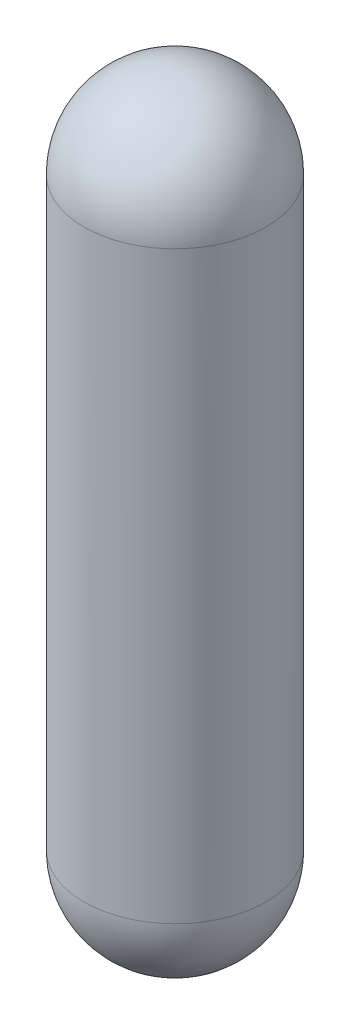
from build123d import *


with BuildPart() as part:
    # Sketch1 → Revolve1 (revolve)
    with BuildSketch(Plane.XY):
        with BuildLine():
            Line((0, 1830), (0, 2115))
            ThreePointArc((0, 2115), (201.525432638, 2031.525432638), (285, 1830))
            Line((285, 1830), (285, 0))
            ThreePointArc((285, 0), (201.525432638, -201.525432638), (0, -285))
            Line((0, -285), (0, 0))
            Line((0, 0), (0, 1830))
        make_face()
    revolve(axis=Axis((0, 0, 0), (0, 1, 0)))


solid = part.part
